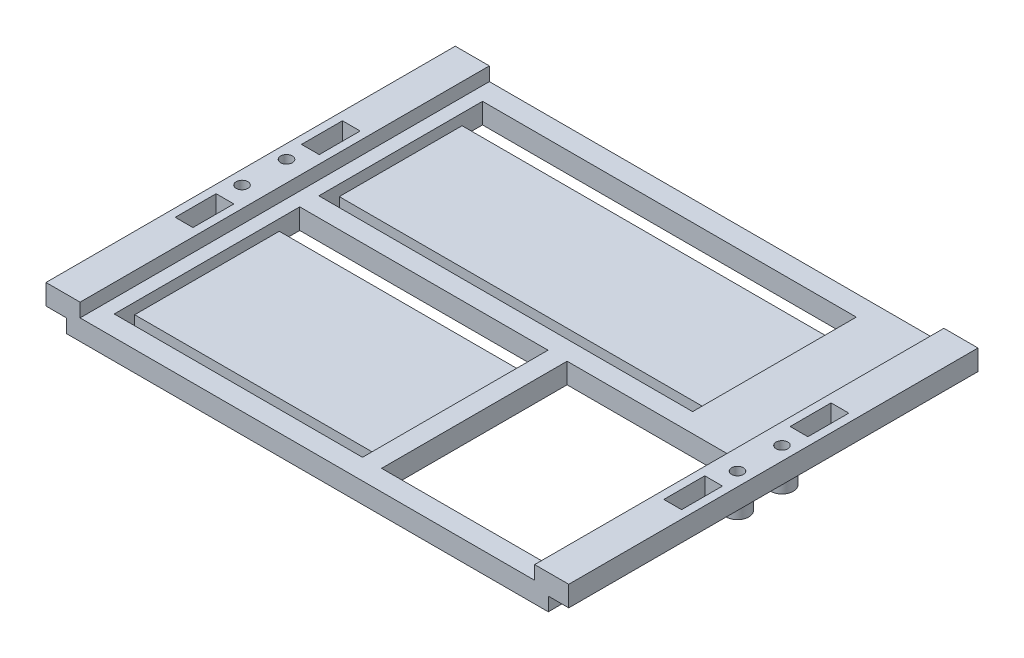
from build123d import *

# Parameters (mm, degrees)
PLATEFRAME_DEPTH          = 150
SKETCH3_R                 = 2.15
HOLESUPPORT_DEPTH         = 7.5
SKETCH4_R                 = 4.15
SKETCH4_R_2               = 2.15
CYLINDRICALSUPPORTS_DEPTH = 12.5
SKETCH8_W                 = 137
SKETCH8_H                 = 60
SKETCH8_W_2               = 91
SKETCH8_H_2               = 68
ITEMLAYOUT_DEPTH          = 4
SKETCH9_W                 = 58.6
SKETCH9_H                 = 68
HOLECUTOUT_DEPTH          = 7.5
SKETCH10_W                = 91
SKETCH10_H                = 7.5
SKETCH10_W_2              = 137
VELCROCUT_DEPTH           = 3.5
SKETCH11_W                = 6.5
SKETCH11_H                = 15
CUT_EXTRUDE1_DEPTH        = 12.5


with BuildPart() as part:
    # Sketch2 → PlateFrame (new body)
    with BuildSketch(Plane.XY):
        Polygon((179.1, 12.5), (191.6, 12.5), (191.6, 5), (184.1, 5), (184.1, 0), (7.5, 0), (7.5, 5), (0, 5), (0, 12.5), (12.5, 12.5), (12.5, 7.5), (179.1, 7.5), align=None)
    extrude(amount=PLATEFRAME_DEPTH)

    # Sketch3 → HoleSupport (cut)
    with BuildSketch(Plane(origin=(0, 12.5, 0), x_dir=(1, 0, 0), z_dir=(0, 1, 0))):
        with Locations((5, -66.85)):
            Circle(SKETCH3_R)
        with Locations((5, -83.15)):
            Circle(SKETCH3_R)
        with Locations((186.6, -66.85)):
            Circle(SKETCH3_R)
        with Locations((186.6, -83.15)):
            Circle(SKETCH3_R)
    extrude(amount=-HOLESUPPORT_DEPTH, mode=Mode.SUBTRACT)

    # Sketch4 → CylindricalSupports (add)
    # profile 1 of 4: a face of its own
    with BuildSketch(Plane(origin=(0, 12.5, 0), x_dir=(1, 0, 0), z_dir=(0, 1, 0))):
        with Locations((186.6, -66.85)):
            Circle(SKETCH4_R)
        with Locations((186.6, -66.85)):
            Circle(SKETCH4_R_2, mode=Mode.SUBTRACT)
    # profile 2 of 4: a face of its own
    with BuildSketch(Plane(origin=(0, 12.5, 0), x_dir=(1, 0, 0), z_dir=(0, 1, 0))):
        with Locations((186.6, -83.15)):
            Circle(SKETCH4_R)
        with Locations((186.6, -83.15)):
            Circle(SKETCH4_R_2, mode=Mode.SUBTRACT)
    # profile 3 of 4: a face of its own
    with BuildSketch(Plane(origin=(0, 12.5, 0), x_dir=(1, 0, 0), z_dir=(0, 1, 0))):
        with Locations((5, -66.85)):
            Circle(SKETCH4_R)
        with Locations((5, -66.85)):
            Circle(SKETCH4_R_2, mode=Mode.SUBTRACT)
    # profile 4 of 4: a face of its own
    with BuildSketch(Plane(origin=(0, 12.5, 0), x_dir=(1, 0, 0), z_dir=(0, 1, 0))):
        with Locations((5, -83.15)):
            Circle(SKETCH4_R)
        with Locations((5, -83.15)):
            Circle(SKETCH4_R_2, mode=Mode.SUBTRACT)
    extrude(amount=-CYLINDRICALSUPPORTS_DEPTH)

    # Sketch8 → ItemLayout (cut)
    with BuildSketch(Plane(origin=(0, 7.5, 0), x_dir=(1, 0, 0), z_dir=(0, 1, 0))):
        with Locations((86, -37.5)):
            Rectangle(SKETCH8_W, SKETCH8_H)
        with Locations((63, -108.5)):
            Rectangle(SKETCH8_W_2, SKETCH8_H_2)
    extrude(amount=-ITEMLAYOUT_DEPTH, mode=Mode.SUBTRACT)

    # Sketch9 → HoleCutout (cut)
    with BuildSketch(Plane(origin=(0, 7.5, 0), x_dir=(1, 0, 0), z_dir=(0, 1, 0))):
        with Locations((144.8, -108.5)):
            Rectangle(SKETCH9_W, SKETCH9_H)
    extrude(amount=-HOLECUTOUT_DEPTH, mode=Mode.SUBTRACT)

    # Sketch10 → VelcroCut (cut)
    with BuildSketch(Plane(origin=(0, 3.5, 0), x_dir=(1, 0, 0), z_dir=(0, 1, 0))):
        with Locations((63, -78.25)):
            Rectangle(SKETCH10_W, SKETCH10_H)
        with Locations((63, -138.75)):
            Rectangle(SKETCH10_W, SKETCH10_H)
        with Locations((86, -11.25)):
            Rectangle(SKETCH10_W_2, SKETCH10_H)
        with Locations((86, -63.75)):
            Rectangle(SKETCH10_W_2, SKETCH10_H)
    extrude(amount=-VELCROCUT_DEPTH, mode=Mode.SUBTRACT)

    # Sketch11 → Cut-Extrude1 (cut)
    with BuildSketch(Plane(origin=(0, 12.5, 0), x_dir=(1, 0, 0), z_dir=(0, 1, 0))):
        with Locations((6.25, -51.85)):
            Rectangle(SKETCH11_W, SKETCH11_H)
        with Locations((185.35, -51.85)):
            Rectangle(SKETCH11_W, SKETCH11_H)
        with Locations((185.35, -98.15)):
            Rectangle(SKETCH11_W, SKETCH11_H)
        with Locations((6.25, -98.15)):
            Rectangle(SKETCH11_W, SKETCH11_H)
    extrude(amount=-CUT_EXTRUDE1_DEPTH, mode=Mode.SUBTRACT)


solid = part.part
